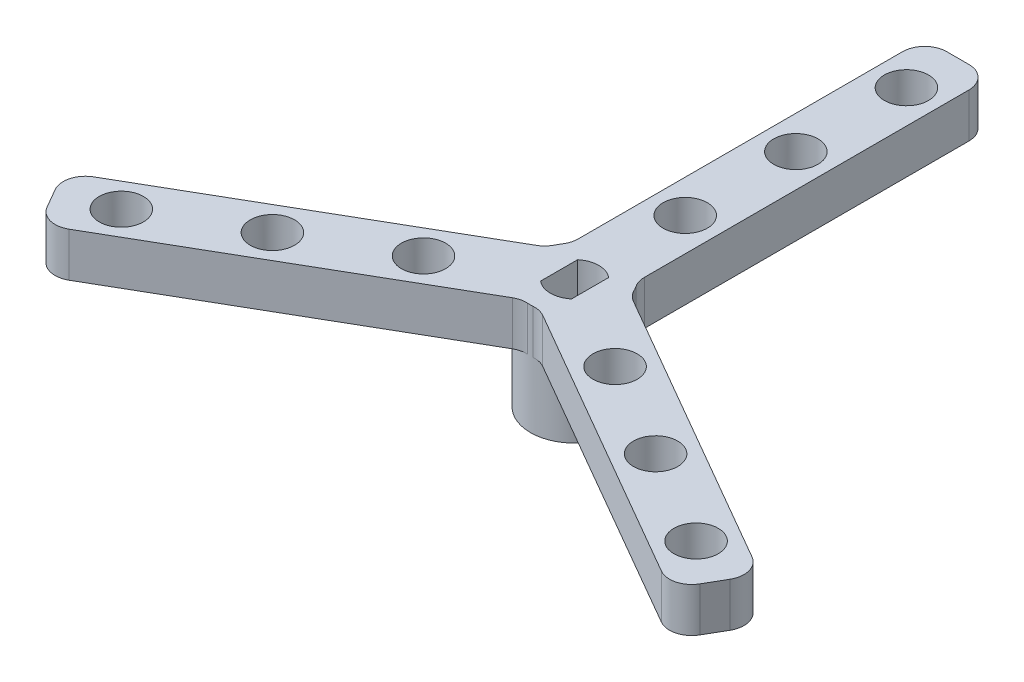
from build123d import *

# Parameters (mm, degrees)
SKETCH1_R           = 5
BOSS_EXTRUDE1_DEPTH = 12.5
SKETCH2_W           = 7.5
SKETCH2_H           = 40
BOSS_EXTRUDE4_DEPTH = 5
SKETCH4_R           = 2.5
CUT_EXTRUDE1_DEPTH  = 100
FILLET1_R           = 2.5
FILLET2_R           = 2.5


with BuildPart() as part:
    # Sketch1 → Boss-Extrude1 (new body)
    with BuildSketch(Plane(origin=(0, 0, 0), x_dir=(1, 0, 0), z_dir=(0, 1, 0))):
        with Locations((0.037460471, 3.715413796)):
            Circle(SKETCH1_R)
        with BuildLine():
            ThreePointArc((-1.712539529, 5.811378349), (0.037460471, 6.446050212), (1.787460471, 5.811378349))
            Line((1.787460471, 5.811378349), (1.787460471, 1.62008566))
            ThreePointArc((1.787460471, 1.62008566), (0.037460471, 0.985413796), (-1.712539529, 1.62008566))
            Line((-1.712539529, 1.62008566), (-1.712539529, 5.811378349))
        make_face(mode=Mode.SUBTRACT)
    extrude(amount=BOSS_EXTRUDE1_DEPTH)

    # Sketch2 → Boss-Extrude4 (add)
    with BuildSketch(Plane(origin=(0, 12.5, 0), x_dir=(1, 0, 0), z_dir=(0, 1, 0))):
        Polygon((4.77657028, 5.309414491), (1.02657028, -1.185776038), (35.667586431, -21.185776038), (39.417586431, -14.690585509), align=None)
        with Locations((0.037460471, 27.022602935)):
            Rectangle(SKETCH2_W, SKETCH2_H)
        Polygon((-4.701649339, 5.309414491), (-0.951649339, -1.185776038), (-35.59266549, -21.185776038), (-39.34266549, -14.690585509), align=None)
    extrude(amount=-BOSS_EXTRUDE4_DEPTH)

    # Sketch4 → Cut-Extrude1 (cut)
    with BuildSketch(Plane(origin=(0, 12.5, 0), x_dir=(1, 0, 0), z_dir=(0, 1, 0))):
        with Locations((0.037460471, 16.216050212)):
            Circle(SKETCH4_R)
        with Locations((0.037460471, 28.716050212)):
            Circle(SKETCH4_R)
        with Locations((0.037460471, 41.216050212)):
            Circle(SKETCH4_R)
        with Locations((-10.788016154, -2.533674249)):
            Circle(SKETCH4_R)
        with Locations((-21.613492779, -8.78339871)):
            Circle(SKETCH4_R)
        with Locations((-32.438969404, -15.033123172)):
            Circle(SKETCH4_R)
        with Locations((10.862937095, -2.533674249)):
            Circle(SKETCH4_R)
        with Locations((21.68841372, -8.78339871)):
            Circle(SKETCH4_R)
        with Locations((32.513890345, -15.033123172)):
            Circle(SKETCH4_R)
    extrude(amount=-CUT_EXTRUDE1_DEPTH, mode=Mode.SUBTRACT)

    # Fillet1
    fillet1_edges = [part.edges().sort_by_distance(p)[0] for p in [
        (4.77657028, 10, -5.309414491),
        (3.787460471, 10, -7.022602935),
        (-3.712539529, 10, -7.022602935),
        (-4.701649339, 10, -5.309414491),
        (-0.951649339, 10, 1.185776038),
        (1.02657028, 10, 1.185776038),
    ]]
    fillet(fillet1_edges, radius=FILLET1_R)

    # Fillet2
    fillet2_edges = [part.edges().sort_by_distance(p)[0] for p in [
        (-3.712539529, 10, -47.022602935),
        (3.787460471, 10, -47.022602935),
        (39.417586431, 10, 14.690585509),
        (35.667586431, 10, 21.185776038),
        (-39.34266549, 10, 14.690585509),
        (-35.59266549, 10, 21.185776038),
    ]]
    fillet(fillet2_edges, radius=FILLET2_R)


solid = part.part
